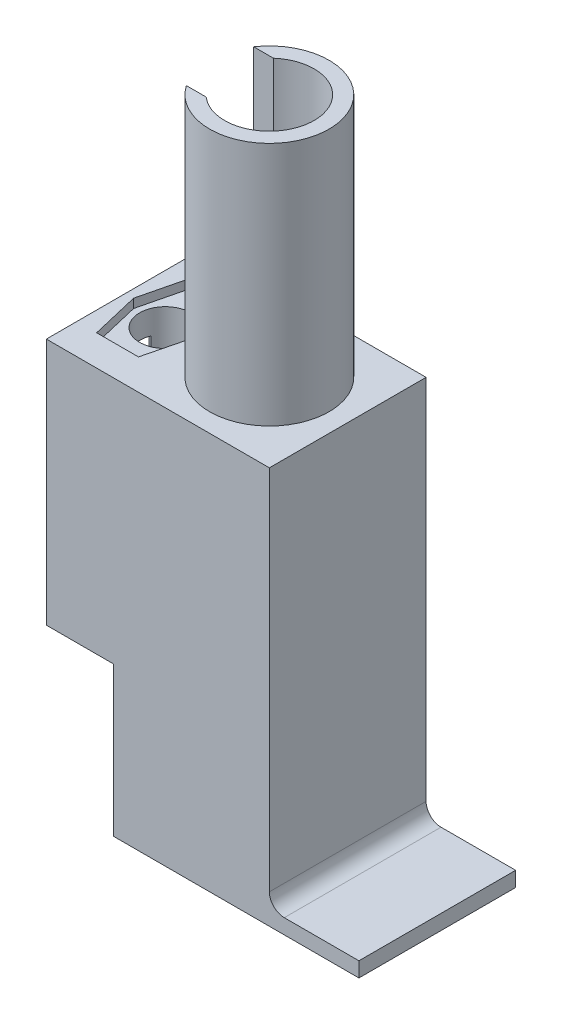
from build123d import *

# Parameters (mm, degrees)
SKETCH1_W                = 74.7
SKETCH1_H                = 52.5
BOSS_EXTRUDE1_DEPTH      = 83
SKETCH4_W                = 42.5
SKETCH4_H                = 42.5
CUT_EXTRUDE1_DEPTH       = 24
SKETCH7_R                = 8.6
CUT_EXTRUDE6_DEPTH       = 130
CUT_EXTRUDE16_DEPTH      = 115.708990493
CUT_EXTRUDE16_DEPTH_BACK = 4.99
SKETCH13_W               = 45.5
SKETCH13_H               = 61
SKETCH15_W               = 6.385819608
SKETCH15_H               = 61
CUT_EXTRUDE17_DEPTH      = 1
SKETCH18_W               = 42.5
SKETCH18_H               = 42.5
BOSS_EXTRUDE2_DEPTH      = 31
SKETCH19_W               = 52.25
SKETCH19_H               = 52.5
BOSS_EXTRUDE3_DEPTH      = 50
SKETCH20_W               = 42.5
SKETCH20_H               = 42.5
CUT_EXTRUDE19_DEPTH      = 23.5
SKETCH21_W               = 52.5
SKETCH21_H               = 5
BOSS_EXTRUDE4_DEPTH      = 30
FILLET1_R                = 5
SKETCH22_R               = 15
CUT_EXTRUDE20_DEPTH      = 120
CUT_EXTRUDE21_DEPTH      = 3
SKETCH24_R               = 20
SKETCH24_R_2             = 15
BOSS_EXTRUDE5_DEPTH      = 82
CUT_EXTRUDE22_START      = -82
CUT_EXTRUDE22_DEPTH      = 82


with BuildPart() as part:
    # Sketch1 → Boss-Extrude1 (new body)
    with BuildSketch(Plane(origin=(0, 0, 0), x_dir=(1, 0, 0), z_dir=(0, 1, 0))):
        Rectangle(SKETCH1_W, SKETCH1_H)
    extrude(amount=BOSS_EXTRUDE1_DEPTH)

    # Sketch4 → Cut-Extrude1 (cut)
    with BuildSketch(Plane.XZ):
        with Locations((11.1, 0)):
            Rectangle(SKETCH4_W, SKETCH4_H)
    extrude(amount=-CUT_EXTRUDE1_DEPTH, mode=Mode.SUBTRACT)

    # Sketch7 → Cut-Extrude6 (cut)
    with BuildSketch(Plane.XZ):
        with Locations((-23.75, 0)):
            Circle(SKETCH7_R)
    extrude(amount=-CUT_EXTRUDE6_DEPTH, mode=Mode.SUBTRACT)

    # Sketch13 → Cut-Extrude16 (cut, two sides: drawn at the far end of the back side and taken through both)
    with BuildSketch(Plane.ZY.offset(37.35).offset(-CUT_EXTRUDE16_DEPTH_BACK)):
        with Locations((0, 41.5)):
            Rectangle(SKETCH13_W, SKETCH13_H)
    extrude(amount=CUT_EXTRUDE16_DEPTH + CUT_EXTRUDE16_DEPTH_BACK, mode=Mode.SUBTRACT)

    # Sketch15 → Cut-Extrude17 (cut)
    with BuildSketch(Plane.ZY.offset(32.36)):
        with Locations((0, 41.5)):
            Rectangle(SKETCH15_W, SKETCH15_H)
    extrude(amount=-CUT_EXTRUDE17_DEPTH, mode=Mode.SUBTRACT)

    # Sketch18 → Boss-Extrude2 (add)
    with BuildSketch(Plane.XZ):
        with Locations((11.1, 0)):
            Rectangle(SKETCH18_W, SKETCH18_H)
    extrude(amount=-BOSS_EXTRUDE2_DEPTH)

    # Sketch19 → Boss-Extrude3 (add)
    with BuildSketch(Plane.XZ):
        with Locations((11.225, 0)):
            Rectangle(SKETCH19_W, SKETCH19_H)
    extrude(amount=BOSS_EXTRUDE3_DEPTH)

    # Sketch20 → Cut-Extrude19 (cut)
    with BuildSketch(Plane.XZ.offset(50)):
        with Locations((11.1, 0)):
            Rectangle(SKETCH20_W, SKETCH20_H)
    extrude(amount=-CUT_EXTRUDE19_DEPTH, mode=Mode.SUBTRACT)

    # Sketch21 → Boss-Extrude4 (add)
    with BuildSketch(Plane(origin=(37.35, 0, 0), x_dir=(0, 0, -1), z_dir=(1, 0, 0))):
        with Locations((0, -47.5)):
            Rectangle(SKETCH21_W, SKETCH21_H)
    extrude(amount=BOSS_EXTRUDE4_DEPTH)

    # Fillet1
    fillet1_edges = [part.edges().sort_by_distance(p)[0] for p in [
        (37.35, -45, 0),
    ]]
    fillet(fillet1_edges, radius=FILLET1_R)

    # Sketch22 → Cut-Extrude20 (cut)
    with BuildSketch(Plane.XZ.offset(26.5)):
        with Locations((11.1, 0)):
            Circle(SKETCH22_R)
    extrude(amount=-CUT_EXTRUDE20_DEPTH, mode=Mode.SUBTRACT)

    # Sketch23 → Cut-Extrude21 (cut)
    with BuildSketch(Plane(origin=(0, 83, 0), x_dir=(1, 0, 0), z_dir=(0, 1, 0))):
        Polygon((-16.75, 16), (-12.788538026, -0.140014893), (-16.75, -16), (-30.75, -16), (-34.596459266, 0.235543482), (-30.75, 16), align=None)
    extrude(amount=-CUT_EXTRUDE21_DEPTH, mode=Mode.SUBTRACT)

    # Sketch24 → Boss-Extrude5 (add)
    with BuildSketch(Plane(origin=(0, 83, 0), x_dir=(1, 0, 0), z_dir=(0, 1, 0))):
        with Locations((11.1, 0)):
            Circle(SKETCH24_R)
        with Locations((11.1, 0)):
            Circle(SKETCH24_R_2, mode=Mode.SUBTRACT)
    extrude(amount=BOSS_EXTRUDE5_DEPTH)

    # Sketch27 → Cut-Extrude22 (cut)
    with BuildSketch(Plane(origin=(0, 165, 0), x_dir=(1, 0, 0), z_dir=(0, 1, 0)).offset(CUT_EXTRUDE22_START)):
        with BuildLine():
            Line((-5.423226258, 11.268673126), (1.199646169, 11.268673126))
            ThreePointArc((1.199646169, 11.268673126), (-3.9, 0), (1.199646169, -11.268673126))
            Line((1.199646169, -11.268673126), (-5.423226258, -11.268673126))
            ThreePointArc((-5.423226258, -11.268673126), (-8.9, 0), (-5.423226258, 11.268673126))
        make_face()
    extrude(amount=CUT_EXTRUDE22_DEPTH, mode=Mode.SUBTRACT)


solid = part.part
